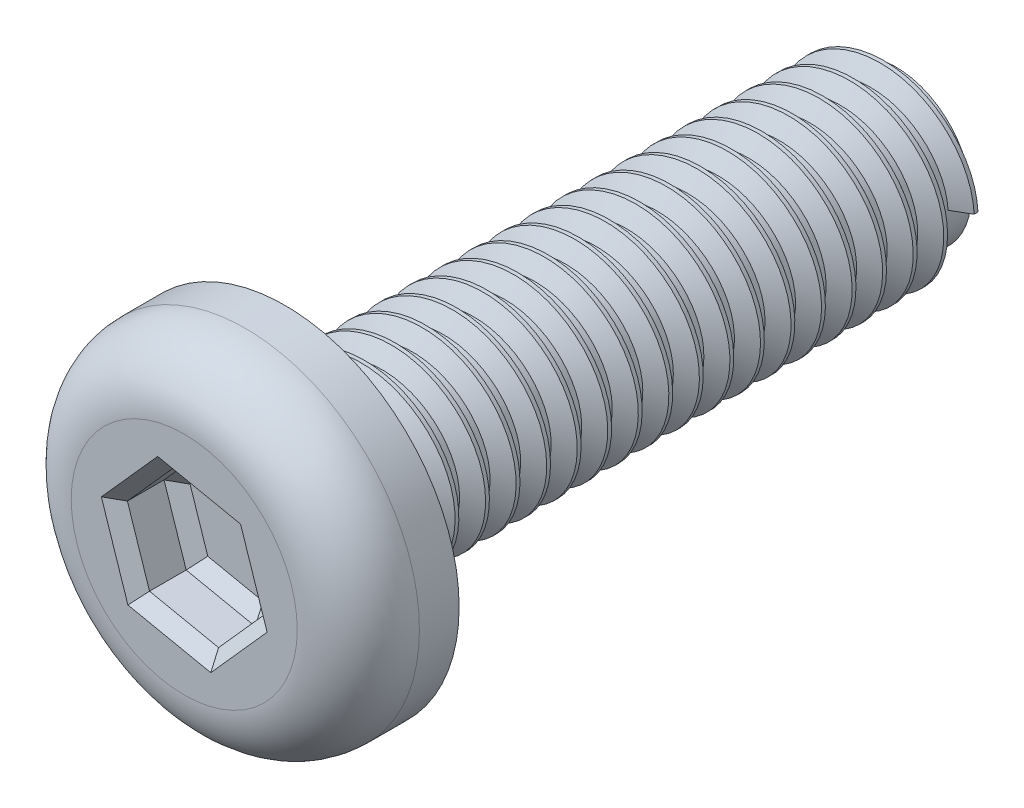
from build123d import *

# Parameters (mm, degrees)
SKETCH_1_R          = 2.85
EXTRUDE_1_DEPTH     = 1.65
SKETCH_2_R          = 1.2295
EXTRUDE_2_DEPTH     = 10
FILLET_1_R          = 1
CUT_EXTRUDE_1_DEPTH = 1
CHAMFER_1_SIZE      = 0.2
THREAD_1_PITCH      = 0.5


with BuildPart() as part:
    # 草图1 → 凸台-拉伸1 (new body)
    with BuildSketch(Plane.XY):
        Circle(SKETCH_1_R)
    extrude(amount=EXTRUDE_1_DEPTH)

    # Sketch 2 → 凸台-拉伸2 (add)
    with BuildSketch(Plane(origin=(0, 0, 0), x_dir=(-1, 0, 0), z_dir=(0, 0, -1))):
        Circle(SKETCH_2_R)
    extrude(amount=EXTRUDE_2_DEPTH)

    # 圆角1
    fillet_1_edges = [part.edges().sort_by_distance(p)[0] for p in [
        (-2.85, 0, 1.65),
    ]]
    fillet(fillet_1_edges, radius=FILLET_1_R)

    # 草图3 → 切除-拉伸1 (cut)
    with BuildSketch(Plane.XY.offset(1.65)):
        Polygon((0.362222341, -1.09641612), (1.130635384, -0.234514311), (0.768413043, 0.861901809), (-0.362222341, 1.09641612), (-1.130635384, 0.234514311), (-0.768413043, -0.861901809), align=None)
    extrude(amount=-CUT_EXTRUDE_1_DEPTH, mode=Mode.SUBTRACT)

    # 倒角1
    chamfer_1_edges = [part.edges().sort_by_distance(p)[0] for p in [
        (-0.203095351, -0.979158965, 0.65),
        (-0.949524213, -0.313693749, 0.65),
        (-0.746428862, 0.665465216, 0.65),
        (0.203095351, 0.979158965, 0.65),
        (0.949524213, 0.313693749, 0.65),
        (0.746428862, -0.665465216, 0.65),
        (-0.203095351, -0.979158965, 1.65),
        (0.746428862, -0.665465216, 1.65),
        (0.949524213, 0.313693749, 1.65),
        (0.203095351, 0.979158965, 1.65),
        (-0.746428862, 0.665465216, 1.65),
        (-0.949524213, -0.313693749, 1.65),
    ]]
    chamfer(chamfer_1_edges, length=CHAMFER_1_SIZE)

    # 螺纹线1: the profile of Sketch 2 2 profile screwed along a right-hand helix of 20 turns, 6 arcs to a turn; built about Z, then put on its axis
    thread_1_z = Axis((0, 0, 0), (0, 0, 1))
    thread_1_corners = [(1.2292, 0, -0.000173205), (1.500132938, 0, 0.156249999), (1.500132938, 0, 0.218749999), (1.2292, 0, 0.375173204)]
    with BuildLine(mode=Mode.PRIVATE) as thread_1_profile:
        Line(thread_1_corners[0], thread_1_corners[1])
        Line(thread_1_corners[1], thread_1_corners[2])
        Line(thread_1_corners[2], thread_1_corners[3])
        Line(thread_1_corners[3], thread_1_corners[0])
    thread_1_cap = Face(thread_1_profile.wire())
    thread_1_turn_angles = [0, 30, 60, 90, 120, 150, 180, 210, 240, 270, 300, 330, 360]
    thread_1_turn_weights = [1, 0.8660254037844387, 1, 0.8660254037844387, 1, 0.8660254037844387, 1, 0.8660254037844387, 1, 0.8660254037844387, 1, 0.8660254037844387, 1]
    thread_1_turn_rails = [Edge.make_bspline([Vector(p[0], p[1], 0).rotate(thread_1_z, thread_1_turn_angles[k]) / thread_1_turn_weights[k] + Vector(0, 0, p[2] + THREAD_1_PITCH * thread_1_turn_angles[k] / 360) for k in range(13)], [0, 0, 0, 1, 1, 2, 2, 3, 3, 4, 4, 5, 5, 6, 6, 6], 2, thread_1_turn_weights) for p in thread_1_corners]
    thread_1_turn_sides = [Face.make_surface_from_curves(thread_1_turn_rails[p[0]], thread_1_turn_rails[p[1]]) for p in [(0, 1), (1, 2), (2, 3), (3, 0)]]
    thread_1 = Plane(origin=(0, 0, -10), x_dir=(1, 0, 0), z_dir=(0, 0, 1)) * Solid(Shell([*[p.moved(Location((0, 0, THREAD_1_PITCH * i))) for i in range(20) for p in thread_1_turn_sides], thread_1_cap, thread_1_cap.rotate(thread_1_z, 7200).moved(Location((0, 0, THREAD_1_PITCH * 7200 / 360)))]))
    add(thread_1)


solid = part.part
